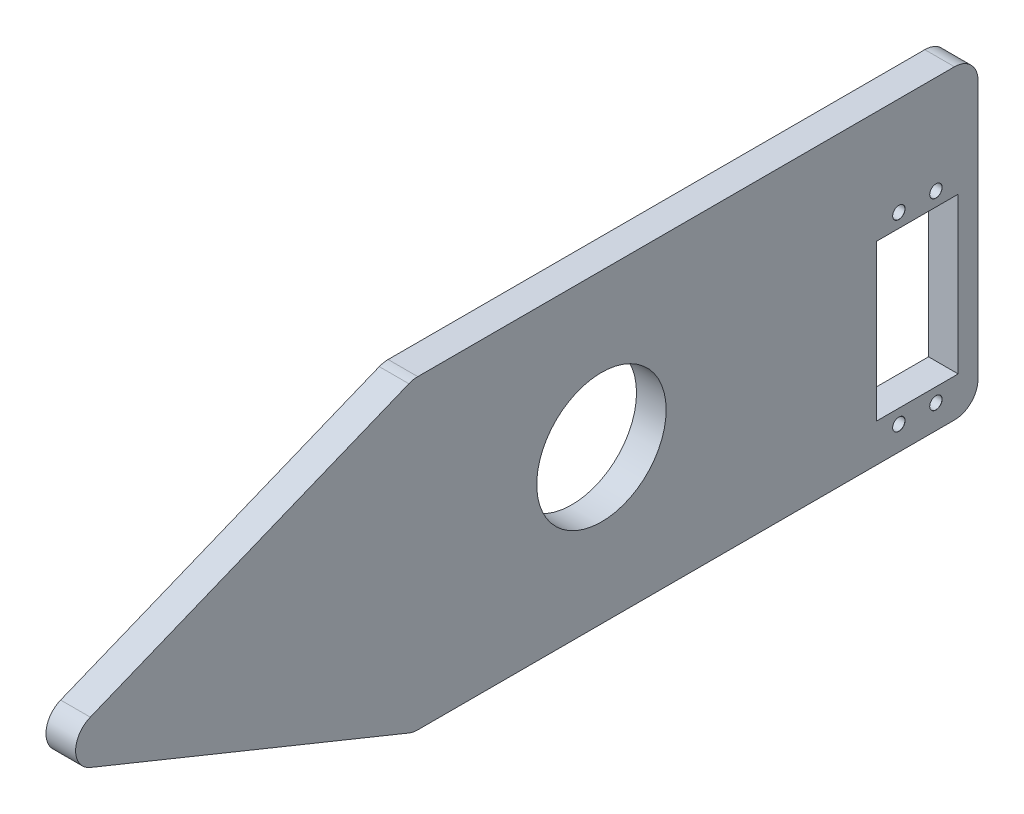
from build123d import *

# Parameters (mm, degrees)
SKETCH1_R                             = 17.4625
BOSS_EXTRUDE2_DEPTH                   = 4.0005
FILLET1_R                             = 6.35
TAP_DRILL_FOR_M4X0_7_TAP1_D           = 3.3
TAP_DRILL_FOR_M4X0_7_TAP1_CSINK_D     = 3.35
TAP_DRILL_FOR_M4X0_7_TAP1_CSINK_ANGLE = 90
SKETCH5_W                             = 42
SKETCH5_H                             = 22
CUT_EXTRUDE1_DEPTH                    = 148.97697313


with BuildPart() as part:
    # Sketch1 → Boss-Extrude2 (new, symmetric)
    with BuildSketch(Plane.YZ):
        Polygon((-41.275, 50.8), (-41.275, -101.6), (41.275, -101.6), (41.275, 50.8), (0, 152.4), align=None)
        Circle(SKETCH1_R, mode=Mode.SUBTRACT)
    extrude(amount=BOSS_EXTRUDE2_DEPTH, both=True)

    # Fillet1
    fillet1_edges = [part.edges().sort_by_distance(p)[0] for p in [
        (0, 41.275, -101.6),
        (0, -41.275, -101.6),
        (0, 0, 152.4),
        (0, -41.275, 50.8),
        (0, 41.275, 50.8),
    ]]
    fillet(fillet1_edges, radius=FILLET1_R)

    # Tap Drill for M4x0.7 Tap1 (through all)
    with Locations(Plane.YZ.offset(4.0005)):
        with Locations((-34.75, -80.25), (-34.75, -90.25), (14.75, -80.25), (14.75, -90.25)):
            CounterSinkHole(TAP_DRILL_FOR_M4X0_7_TAP1_D / 2, TAP_DRILL_FOR_M4X0_7_TAP1_CSINK_D / 2, counter_sink_angle=TAP_DRILL_FOR_M4X0_7_TAP1_CSINK_ANGLE)

    # Sketch5 → Cut-Extrude1 (cut, through all)
    with BuildSketch(Plane.YZ.offset(4.0005)):
        with Locations((-10, -85.25)):
            Rectangle(SKETCH5_W, SKETCH5_H)
    extrude(amount=-CUT_EXTRUDE1_DEPTH, mode=Mode.SUBTRACT)


solid = part.part
